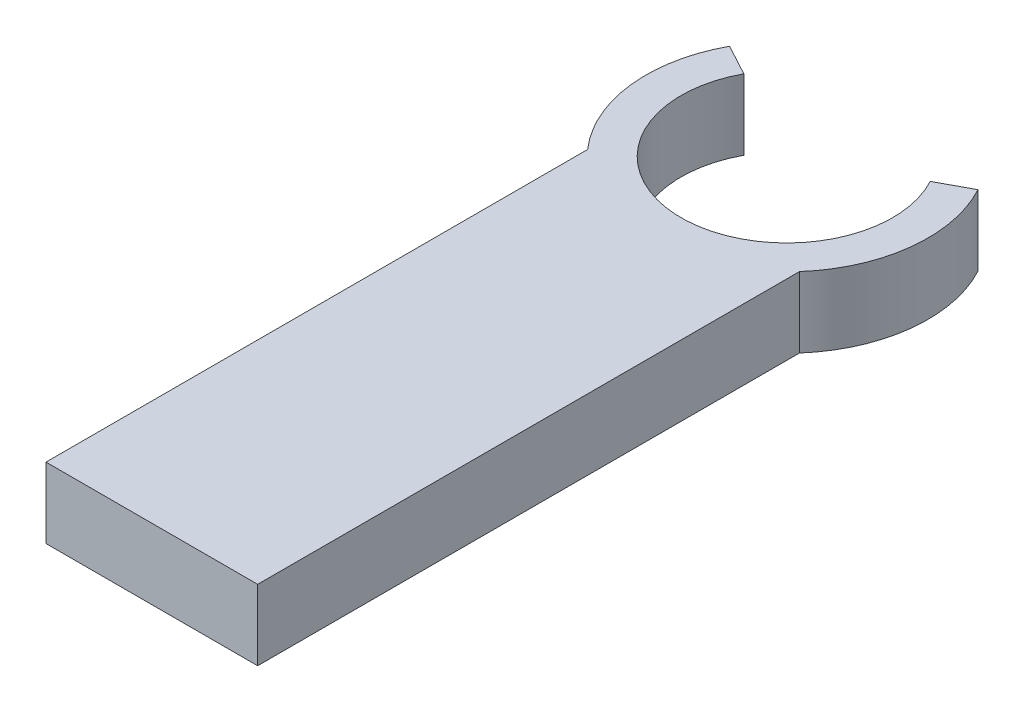
from build123d import *

# Parameters (mm, degrees)
BOSS_EXTRUDE1_DEPTH = 10


with BuildPart() as part:
    # Sketch1 → Boss-Extrude1 (new body)
    with BuildSketch(Plane(origin=(0, 0, 0), x_dir=(1, 0, 0), z_dir=(0, 1, 0))):
        with BuildLine():
            Line((-15, -90), (15, -90))
            Line((15, -90), (15.009309227, -13.218193391))
            ThreePointArc((15.009309227, -13.218193391), (19.870372564, -2.273388257), (17.606978586, 9.486532826))
            Line((17.606978586, 9.486532826), (13.20523394, 7.11489962))
            ThreePointArc((13.20523394, 7.11489962), (0, -15), (-13.20523394, 7.11489962))
            Line((-13.20523394, 7.11489962), (-17.606978586, 9.486532826))
            ThreePointArc((-17.606978586, 9.486532826), (-19.868768055, -2.287368787), (-14.990693332, -13.239301848))
            Line((-14.990693332, -13.239301848), (-15, -90))
        make_face()
    extrude(amount=BOSS_EXTRUDE1_DEPTH)


solid = part.part
